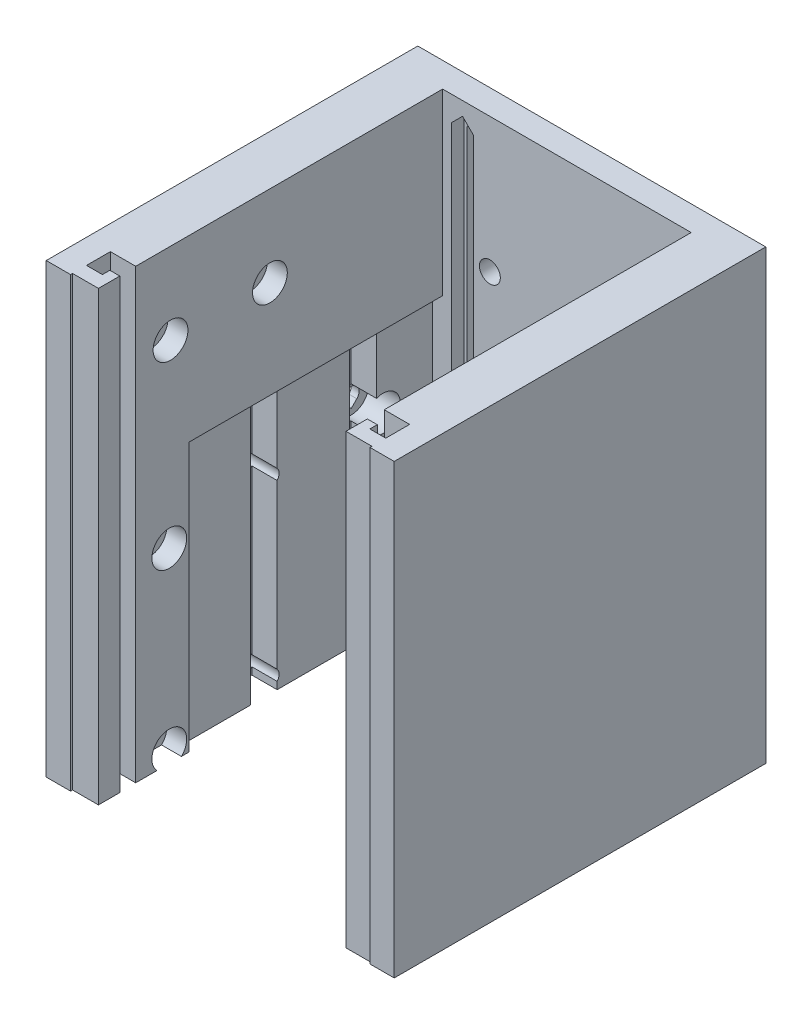
from build123d import *

# Parameters (mm, degrees)
SKETCH1_W                 = 90
SKETCH1_H                 = 70
BOSS_EXTRUDE1_DEPTH       = 5
SKETCH2_W                 = 8
SKETCH2_H                 = 90
BOSS_EXTRUDE2_DEPTH       = 51
SKETCH3_W                 = 5.1
SKETCH3_H                 = 5.4
CUT_EXTRUDE1_DEPTH        = 54
SKETCH14_W                = 10
SKETCH14_H                = 90
BOSS_EXTRUDE6_DEPTH       = 11.75
SKETCH15_W                = 4.9
SKETCH15_H                = 90
BOSS_EXTRUDE7_DEPTH       = 7
SKETCH17_W                = 90
SKETCH17_H                = 2.8
BOSS_EXTRUDE8_DEPTH       = 5
SKETCH16_W                = 5.1
SKETCH16_H                = 90
CUT_EXTRUDE3_DEPTH        = 1
BOSS_EXTRUDE9_START       = -1.5
SKETCH18_W                = 2
SKETCH18_H                = 90
BOSS_EXTRUDE9_DEPTH       = 4.3
SKETCH43_W                = 36
SKETCH43_H                = 51
BOSS_EXTRUDE10_DEPTH      = 2
CUT_EXTRUDE4_START        = -10
SKETCH44_R                = 1.6
CUT_EXTRUDE4_DEPTH        = 10
SKETCH45_R                = 1.6
CUT_EXTRUDE5_DEPTH        = 95.008310803
CUT_EXTRUDE6_DEPTH        = 2.5
CUT_EXTRUDE7_DEPTH        = 2.5
ADVANCEDHOLE4_START       = -33.4
ADVANCEDHOLE4_OUTLINE_R   = 1.6
ADVANCEDHOLE4_OUTLINE_R_2 = 3.5
ADVANCEDHOLE4_DEPTH       = 6.4
ADVANCEDHOLE5_START       = -29
ADVANCEDHOLE5_OUTLINE_R   = 1.6
ADVANCEDHOLE5_OUTLINE_R_2 = 3.5
ADVANCEDHOLE5_DEPTH       = 4
CUT_EXTRUDE8_REACH        = 113.86
SKETCH65_R                = 2.1
CUT_EXTRUDE9_DEPTH        = 10


# Read off the part's stored shape, not the designer's step: AdvancedHole4, AdvancedHole5
with BuildPart() as part:
    # Sketch1 → Boss-Extrude1 (new body)
    with BuildSketch(Plane(origin=(0, 0, 0), x_dir=(0, 1, 0), z_dir=(0, 0, 1))):
        Rectangle(SKETCH1_W, SKETCH1_H)
    extrude(amount=BOSS_EXTRUDE1_DEPTH)

    # Sketch2 → Boss-Extrude2 (add)
    with BuildSketch(Plane.XY.offset(5)):
        with Locations((-31, 0)):
            Rectangle(SKETCH2_W, SKETCH2_H)
        with Locations((31, 0)):
            Rectangle(SKETCH2_W, SKETCH2_H)
    extrude(amount=BOSS_EXTRUDE2_DEPTH)

    # Sketch3 → Cut-Extrude1 (cut)
    with BuildSketch(Plane.XZ.offset(45)):
        with Locations((-29.55, 19)):
            Rectangle(SKETCH3_W, SKETCH3_H)
        with Locations((-29.55, 39)):
            Rectangle(SKETCH3_W, SKETCH3_H)
        with Locations((29.55, 19)):
            Rectangle(SKETCH3_W, SKETCH3_H)
        with Locations((29.55, 39)):
            Rectangle(SKETCH3_W, SKETCH3_H)
    extrude(amount=-CUT_EXTRUDE1_DEPTH, mode=Mode.SUBTRACT)

    # Sketch14 → Boss-Extrude6 (add)
    with BuildSketch(Plane.XY.offset(56)):
        with Locations((30, 0)):
            Rectangle(SKETCH14_W, SKETCH14_H)
    boss_extrude6 = extrude(amount=BOSS_EXTRUDE6_DEPTH)

    # Sketch15 → Boss-Extrude7 (add)
    with BuildSketch(Plane.XY.offset(67.75)):
        with Locations((32.55, 0)):
            Rectangle(SKETCH15_W, SKETCH15_H)
    boss_extrude7 = extrude(amount=BOSS_EXTRUDE7_DEPTH)

    # Sketch17 → Boss-Extrude8 (add)
    with BuildSketch(Plane(origin=(30.1, 0, 0), x_dir=(0, -1, 0), z_dir=(-1, 0, 0))):
        with Locations((0, 72.95)):
            Rectangle(SKETCH17_W, SKETCH17_H)
    boss_extrude8 = extrude(amount=BOSS_EXTRUDE8_DEPTH)

    # Sketch16 → Cut-Extrude3 (cut)
    with BuildSketch(Plane.XY.offset(67.75)):
        with Locations((27.55, 0)):
            Rectangle(SKETCH16_W, SKETCH16_H)
    cut_extrude3 = extrude(amount=-CUT_EXTRUDE3_DEPTH, mode=Mode.SUBTRACT)

    # Sketch18 → Boss-Extrude9 (add)
    with BuildSketch(Plane.XY.offset(71.55).offset(BOSS_EXTRUDE9_START)):
        with Locations((25.9, 0)):
            Rectangle(SKETCH18_W, SKETCH18_H)
    boss_extrude9 = extrude(amount=BOSS_EXTRUDE9_DEPTH)

    # Sketch43 → Boss-Extrude10 (add)
    with BuildSketch(Plane(origin=(27, 0, 0), x_dir=(0, -1, 0), z_dir=(-1, 0, 0))):
        with Locations((-27, 30.5)):
            Rectangle(SKETCH43_W, SKETCH43_H)
    boss_extrude10 = extrude(amount=BOSS_EXTRUDE10_DEPTH)

    # Mirror2: Boss-Extrude6, Boss-Extrude7, Boss-Extrude8, Cut-Extrude3, Boss-Extrude9, Boss-Extrude10 across plane
    add(boss_extrude6.mirror(Plane(origin=(0, 0, 0), x_dir=(0, 0, 1), z_dir=(1, 0, 0))))
    add(boss_extrude7.mirror(Plane(origin=(0, 0, 0), x_dir=(0, 0, 1), z_dir=(1, 0, 0))))
    add(boss_extrude8.mirror(Plane(origin=(0, 0, 0), x_dir=(0, 0, 1), z_dir=(1, 0, 0))))
    add(cut_extrude3.mirror(Plane(origin=(0, 0, 0), x_dir=(0, 0, 1), z_dir=(1, 0, 0))), mode=Mode.SUBTRACT)
    add(boss_extrude9.mirror(Plane(origin=(0, 0, 0), x_dir=(0, 0, 1), z_dir=(1, 0, 0))))
    add(boss_extrude10.mirror(Plane(origin=(0, 0, 0), x_dir=(0, 0, 1), z_dir=(1, 0, 0))))

    # Sketch44 → Cut-Extrude4 (cut)
    with BuildSketch(Plane(origin=(-35, 0, 0), x_dir=(0, -1, 0), z_dir=(-1, 0, 0)).offset(CUT_EXTRUDE4_START)):
        with Locations(Location((42.5, 15, 0), (0, 0, 90))):
            Circle(SKETCH44_R)
        with Locations(Location((42.484661232, 37.5, 0), (0, 0, 90))):
            Circle(SKETCH44_R)
        with Locations(Location((42.5, 60, 0), (0, 0, 90))):
            Circle(SKETCH44_R)
        with Locations(Location((7.5, 60, 0), (0, 0, 90))):
            Circle(SKETCH44_R)
        with Locations(Location((7.484661232, 37.5, 0), (0, 0, 90))):
            Circle(SKETCH44_R)
        with Locations(Location((-28.623308021, 39.75, 0), (0, 0, 90))):
            Circle(SKETCH44_R)
        with Locations(Location((-28.623308021, 59.75, 0), (0, 0, 90))):
            Circle(SKETCH44_R)
        with Locations(Location((7.590893279, 15, 0), (0, 0, 90))):
            Circle(SKETCH44_R)
    extrude(amount=CUT_EXTRUDE4_DEPTH, mode=Mode.SUBTRACT)

    # Sketch45 → Cut-Extrude5 (cut, through all)
    with BuildSketch(Plane(origin=(0, 0, 0), x_dir=(1, 0, 0), z_dir=(0, 0, -1))):
        with Locations(Location((-21, 17.516567366, 0), (0, 0, 180))):
            Circle(SKETCH45_R)
    extrude(amount=-CUT_EXTRUDE5_DEPTH, mode=Mode.SUBTRACT)

    # Sketch46 → Cut-Extrude6 (cut)
    with BuildSketch(Plane(origin=(0, 0, 5), x_dir=(1, 0, 0), z_dir=(0, 0, -1))):
        Polygon((-18.75, 40.280204311), (-18.75, -40.004074809), (-21, -42.254074809), (-23.25, -40.004074809), (-23.25, 40.280204311), (-21, 42.530204311), align=None)
    extrude(amount=CUT_EXTRUDE6_DEPTH, mode=Mode.SUBTRACT)

    # Sketch49 → Cut-Extrude7 (cut)
    with BuildSketch(Plane(origin=(0, 0, 0), x_dir=(1, 0, 0), z_dir=(0, 0, -1))):
        Polygon((-19.4, 40.26), (-19.4, -38.4), (-21, -40), (-22.6, -38.4), (-22.6, 40.26), (-21, 41.86), align=None)
    extrude(amount=-CUT_EXTRUDE7_DEPTH, mode=Mode.SUBTRACT)

    # AdvancedHole4 outline → AdvancedHole4 (cut)
    # profile 1 of 2: a face of its own
    with BuildSketch(Plane.YZ.offset(ADVANCEDHOLE4_START)):
        with BuildLine():
            Line((-45, 16.3), (-45, 12.550510257))
            ThreePointArc((-45, 12.550510257), (-39, 15), (-45, 17.449489743))
            Line((-45, 17.449489743), (-45, 16.3))
        make_face()
        with Locations((-42.5, 15)):
            Circle(ADVANCEDHOLE4_OUTLINE_R, mode=Mode.SUBTRACT)
    # profile 2 of 2: a face of its own
    with BuildSketch(Plane.YZ.offset(ADVANCEDHOLE4_START)):
        with Locations((-7.500016499, 15)):
            Circle(ADVANCEDHOLE4_OUTLINE_R_2)
        with Locations((-7.590893279, 15)):
            Circle(ADVANCEDHOLE4_OUTLINE_R, mode=Mode.SUBTRACT)
    extrude(amount=ADVANCEDHOLE4_DEPTH, mode=Mode.SUBTRACT)

    # AdvancedHole5 outline → AdvancedHole5 (cut)
    # profile 1 of 4: a face of its own
    with BuildSketch(Plane.YZ.offset(ADVANCEDHOLE5_START)):
        with BuildLine():
            Line((-45, 62.449489743), (-45, 57.550510257))
            ThreePointArc((-45, 57.550510257), (-39, 60), (-45, 62.449489743))
        make_face()
        with Locations((-42.5, 60)):
            Circle(ADVANCEDHOLE5_OUTLINE_R, mode=Mode.SUBTRACT)
    # profile 2 of 4: a face of its own
    with BuildSketch(Plane.YZ.offset(ADVANCEDHOLE5_START)):
        with Locations((28.623308021, 39.75)):
            Circle(ADVANCEDHOLE5_OUTLINE_R_2)
        with Locations((28.623308021, 39.75)):
            Circle(ADVANCEDHOLE5_OUTLINE_R, mode=Mode.SUBTRACT)
    # profile 3 of 4: a face of its own
    with BuildSketch(Plane.YZ.offset(ADVANCEDHOLE5_START)):
        with Locations((-7.5, 60)):
            Circle(ADVANCEDHOLE5_OUTLINE_R_2)
        with Locations((-7.5, 60)):
            Circle(ADVANCEDHOLE5_OUTLINE_R, mode=Mode.SUBTRACT)
    # profile 4 of 4: a face of its own
    with BuildSketch(Plane.YZ.offset(ADVANCEDHOLE5_START)):
        with Locations((28.623308021, 59.75)):
            Circle(ADVANCEDHOLE5_OUTLINE_R_2)
        with Locations((28.623308021, 59.75)):
            Circle(ADVANCEDHOLE5_OUTLINE_R, mode=Mode.SUBTRACT)
    extrude(amount=ADVANCEDHOLE5_DEPTH, mode=Mode.SUBTRACT)

    # Sketch64 → Cut-Extrude8 (cut, up to next)
    with BuildSketch(Plane(origin=(-35, 0, 0), x_dir=(0, -1, 0), z_dir=(-1, 0, 0)), mode=Mode.PRIVATE) as cut_extrude8_sk1:
        with BuildLine():
            Line((-27.491937171, 60.88137085), (-26.360566322, 59.75))
            Line((-26.360566322, 59.75), (-27.491937171, 58.61862915))
            ThreePointArc((-27.491937171, 58.61862915), (-30.223308021, 59.75), (-27.491937171, 60.88137085))
        make_face()
    cut_extrude8_tool1 = extrude(cut_extrude8_sk1.sketch, amount=-CUT_EXTRUDE8_REACH, mode=Mode.PRIVATE) & part.part
    # Sketch64 → Cut-Extrude8 (cut, up to next)
    with BuildSketch(Plane(origin=(-35, 0, 0), x_dir=(0, -1, 0), z_dir=(-1, 0, 0)), mode=Mode.PRIVATE) as cut_extrude8_sk2:
        with BuildLine():
            Line((-27.491937171, 40.88137085), (-26.360566322, 39.75))
            Line((-26.360566322, 39.75), (-27.491937171, 38.61862915))
            ThreePointArc((-27.491937171, 38.61862915), (-30.223308021, 39.75), (-27.491937171, 40.88137085))
        make_face()
    cut_extrude8_tool2 = extrude(cut_extrude8_sk2.sketch, amount=-CUT_EXTRUDE8_REACH, mode=Mode.PRIVATE) & part.part
    # Sketch64 → Cut-Extrude8 (cut, up to next)
    with BuildSketch(Plane(origin=(-35, 0, 0), x_dir=(0, -1, 0), z_dir=(-1, 0, 0)), mode=Mode.PRIVATE) as cut_extrude8_sk3:
        with BuildLine():
            Line((8.722264129, 16.13137085), (9.853634979, 15))
            Line((9.853634979, 15), (8.722264129, 13.86862915))
            ThreePointArc((8.722264129, 13.86862915), (5.990893279, 15), (8.722264129, 16.13137085))
        make_face()
    cut_extrude8_tool3 = extrude(cut_extrude8_sk3.sketch, amount=-CUT_EXTRUDE8_REACH, mode=Mode.PRIVATE) & part.part
    # Sketch64 → Cut-Extrude8 (cut, up to next)
    with BuildSketch(Plane(origin=(-35, 0, 0), x_dir=(0, -1, 0), z_dir=(-1, 0, 0)), mode=Mode.PRIVATE) as cut_extrude8_sk4:
        with BuildLine():
            Line((8.616032082, 38.63137085), (9.747402932, 37.5))
            Line((9.747402932, 37.5), (8.616032082, 36.36862915))
            ThreePointArc((8.616032082, 36.36862915), (5.884661232, 37.5), (8.616032082, 38.63137085))
        make_face()
    cut_extrude8_tool4 = extrude(cut_extrude8_sk4.sketch, amount=-CUT_EXTRUDE8_REACH, mode=Mode.PRIVATE) & part.part
    # Sketch64 → Cut-Extrude8 (cut, up to next)
    with BuildSketch(Plane(origin=(-35, 0, 0), x_dir=(0, -1, 0), z_dir=(-1, 0, 0)), mode=Mode.PRIVATE) as cut_extrude8_sk5:
        with BuildLine():
            Line((8.63137085, 61.13137085), (9.7627417, 60))
            Line((9.7627417, 60), (8.63137085, 58.86862915))
            ThreePointArc((8.63137085, 58.86862915), (5.9, 60), (8.63137085, 61.13137085))
        make_face()
    cut_extrude8_tool5 = extrude(cut_extrude8_sk5.sketch, amount=-CUT_EXTRUDE8_REACH, mode=Mode.PRIVATE) & part.part
    # Sketch64 → Cut-Extrude8 (cut, up to next)
    with BuildSketch(Plane(origin=(-35, 0, 0), x_dir=(0, -1, 0), z_dir=(-1, 0, 0)), mode=Mode.PRIVATE) as cut_extrude8_sk6:
        with BuildLine():
            Line((41.36862915, 58.86862915), (40.2372583, 60))
            Line((40.2372583, 60), (41.36862915, 61.13137085))
            ThreePointArc((41.36862915, 61.13137085), (44.1, 60), (41.36862915, 58.86862915))
        make_face()
    cut_extrude8_tool6 = extrude(cut_extrude8_sk6.sketch, amount=-CUT_EXTRUDE8_REACH, mode=Mode.PRIVATE) & part.part
    # Sketch64 → Cut-Extrude8 (cut, up to next)
    with BuildSketch(Plane(origin=(-35, 0, 0), x_dir=(0, -1, 0), z_dir=(-1, 0, 0)), mode=Mode.PRIVATE) as cut_extrude8_sk7:
        with BuildLine():
            Line((41.353290382, 36.36862915), (40.221919532, 37.5))
            Line((40.221919532, 37.5), (41.353290382, 38.63137085))
            ThreePointArc((41.353290382, 38.63137085), (44.084661232, 37.5), (41.353290382, 36.36862915))
        make_face()
    cut_extrude8_tool7 = extrude(cut_extrude8_sk7.sketch, amount=-CUT_EXTRUDE8_REACH, mode=Mode.PRIVATE) & part.part
    # Sketch64 → Cut-Extrude8 (cut, up to next)
    with BuildSketch(Plane(origin=(-35, 0, 0), x_dir=(0, -1, 0), z_dir=(-1, 0, 0)), mode=Mode.PRIVATE) as cut_extrude8_sk8:
        with BuildLine():
            Line((41.36862915, 13.86862915), (40.2372583, 15))
            Line((40.2372583, 15), (41.36862915, 16.13137085))
            ThreePointArc((41.36862915, 16.13137085), (44.1, 15), (41.36862915, 13.86862915))
        make_face()
    cut_extrude8_tool8 = extrude(cut_extrude8_sk8.sketch, amount=-CUT_EXTRUDE8_REACH, mode=Mode.PRIVATE) & part.part
    add(cut_extrude8_tool1.solids().sort_by_distance((-35, 28.510942, 59.75))[0], mode=Mode.SUBTRACT)
    add(cut_extrude8_tool2.solids().sort_by_distance((-35, 28.510942, 39.75))[0], mode=Mode.SUBTRACT)
    add(cut_extrude8_tool3.solids().sort_by_distance((-35, -7.70326, 15))[0], mode=Mode.SUBTRACT)
    add(cut_extrude8_tool4.solids().sort_by_distance((-35, -7.597028, 37.5))[0], mode=Mode.SUBTRACT)
    add(cut_extrude8_tool5.solids().sort_by_distance((-35, -7.612366, 60))[0], mode=Mode.SUBTRACT)
    add(cut_extrude8_tool6.solids().sort_by_distance((-35, -42.387634, 60))[0], mode=Mode.SUBTRACT)
    add(cut_extrude8_tool7.solids().sort_by_distance((-35, -42.372295, 37.5))[0], mode=Mode.SUBTRACT)
    add(cut_extrude8_tool8.solids().sort_by_distance((-35, -42.387634, 15))[0], mode=Mode.SUBTRACT)

    # Sketch65 → Cut-Extrude9 (cut)
    with BuildSketch(Plane.XY.offset(5)):
        with Locations((17.6, 12.1)):
            Circle(SKETCH65_R)
        with Locations((-15.5, 17.9)):
            Circle(SKETCH65_R)
    extrude(amount=-CUT_EXTRUDE9_DEPTH, mode=Mode.SUBTRACT)


solid = part.part
